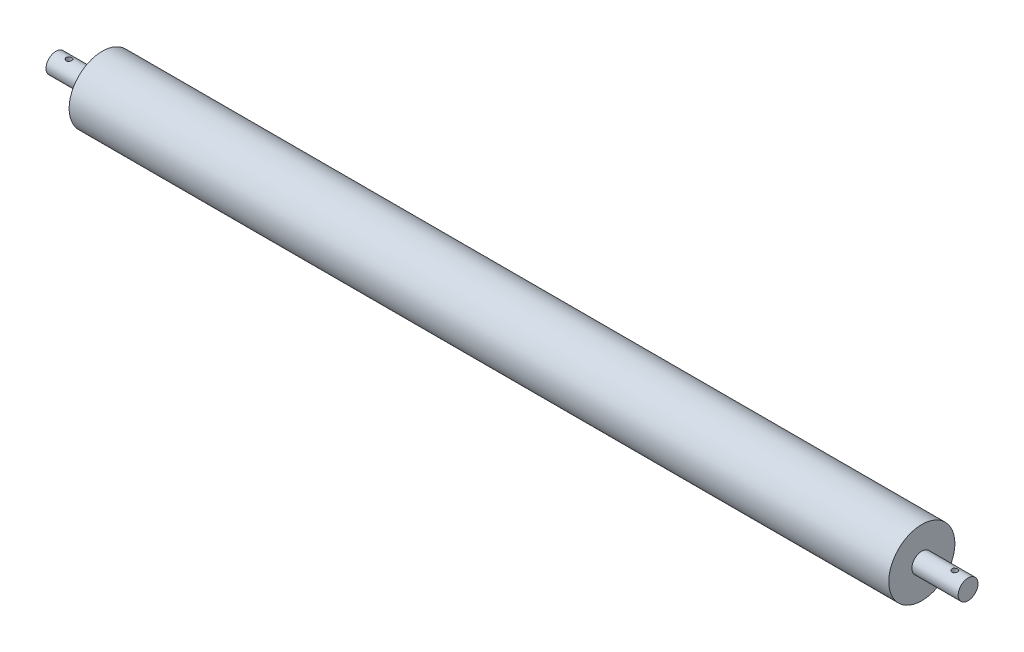
from build123d import *


with BuildPart() as part:
    # 草图1 → 旋转1 (revolve)
    with BuildSketch(Plane.XY):
        Polygon((-310, 25), (310, 25), (310, 7.5), (345, 7.5), (345, 0), (-345, 0), (-345, 7.5), (-310, 7.5), align=None)
    revolve(axis=Axis((-345, 0, 0), (1, 0, 0)))

    # 草图3 → M5 螺纹孔1 (revolve, cut)
    with BuildSketch(Plane(origin=(-335, -7.5, 0), x_dir=(0, 0, -1), z_dir=(1, 0, 0))):
        Polygon((0, 0), (0, 51.2618073), (2.1, 50), (2.1, 0), align=None)
    hole_wizard_m5_1 = revolve(axis=Axis((-335, -13.85, 0), (0, 1, 0)), mode=Mode.SUBTRACT)

    # 镜向1: M5 螺纹孔1 across plane
    add(hole_wizard_m5_1.mirror(Plane(origin=(0, 0, 0), x_dir=(0, 0, 1), z_dir=(1, 0, 0))), mode=Mode.SUBTRACT)


solid = part.part
